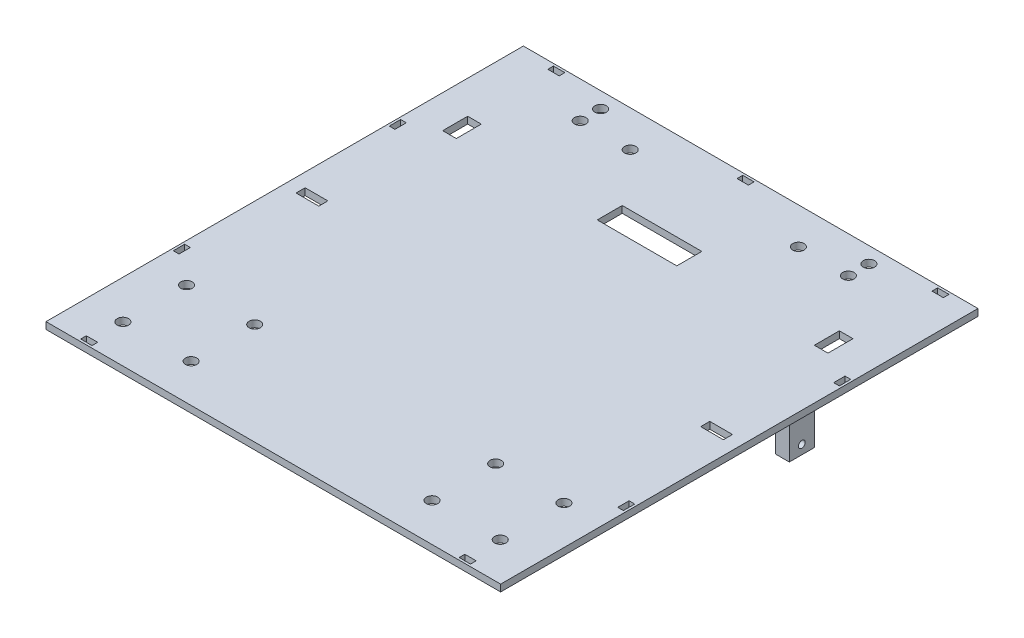
from build123d import *

# Parameters (mm, degrees)
SKETCH1_W              = 200
SKETCH1_H              = 210
SKETCH1_R              = 2.5
SKETCH1_R_2            = 2.49585759
SKETCH1_W_2            = 10
SKETCH1_H_2            = 4
SKETCH1_W_3            = 6
SKETCH1_H_3            = 11
SKETCH1_W_4            = 5
SKETCH1_H_4            = 2.5
SKETCH1_W_5            = 2.5
SKETCH1_H_5            = 5
SKETCH1_W_6            = 35
MAINBODY_DEPTH         = 1
SAYAPRODA_DEPTH        = 3
SAYAPRODA_DEPTH_BACK   = 30
SKETCH1_4_W            = 6
SKETCH1_4_H            = 11
SAYAPRODA_2_DEPTH      = 3
SAYAPRODA_2_DEPTH_BACK = 30
SKETCH9_W              = 1.5
SKETCH9_H              = 184
HOLE1_AT_2_COUNT       = 2
HOLE1_AT_2_PITCH       = 17
HOLE1_AT_3_COUNT       = 2
HOLE1_AT_3_PITCH       = 18.271297686
HOLE1_AT_4_COUNT       = 2
HOLE1_AT_4_PITCH       = 19.759178985
HOLE1_AT_5_COUNT       = 2
HOLE1_AT_5_PITCH       = 21.121723019
SKETCH1_7_W            = 200
SKETCH1_7_H            = 210
SKETCH1_7_R            = 2.5
SKETCH1_7_R_2          = 2.49585759
SKETCH1_7_W_2          = 10
SKETCH1_7_H_2          = 4
SKETCH1_7_W_3          = 6
SKETCH1_7_H_3          = 11
SKETCH1_7_W_4          = 5
SKETCH1_7_H_4          = 2.5
SKETCH1_7_W_5          = 2.5
SKETCH1_7_H_5          = 5
SKETCH1_7_W_6          = 35
BOSS_EXTRUDE1_DEPTH    = 3


with BuildPart() as part:
    # Sketch1 → MainBody (new body)
    with BuildSketch(Plane(origin=(0, 0, 0), x_dir=(1, 0, 0), z_dir=(0, 1, 0))):
        Rectangle(SKETCH1_W, SKETCH1_H)
        with Locations((-59, 98)):
            Circle(SKETCH1_R, mode=Mode.SUBTRACT)
        with Locations((-59, 89)):
            Circle(SKETCH1_R, mode=Mode.SUBTRACT)
        with Locations((-37, 89)):
            Circle(SKETCH1_R, mode=Mode.SUBTRACT)
        with Locations((59, 98)):
            Circle(SKETCH1_R, mode=Mode.SUBTRACT)
        with Locations((59, 89)):
            Circle(SKETCH1_R, mode=Mode.SUBTRACT)
        with Locations((37, 89)):
            Circle(SKETCH1_R, mode=Mode.SUBTRACT)
        with Locations((83, -88.17530204)):
            Circle(SKETCH1_R, mode=Mode.SUBTRACT)
        with Locations((83, -60.17530204)):
            Circle(SKETCH1_R_2, mode=Mode.SUBTRACT)
        with Locations((53, -88.17530204)):
            Circle(SKETCH1_R, mode=Mode.SUBTRACT)
        with Locations((53, -60.17530204)):
            Circle(SKETCH1_R, mode=Mode.SUBTRACT)
        with Locations((-83, -88.17530204)):
            Circle(SKETCH1_R, mode=Mode.SUBTRACT)
        with Locations((-53, -88.17530204)):
            Circle(SKETCH1_R, mode=Mode.SUBTRACT)
        with Locations((-53, -60.17530204)):
            Circle(SKETCH1_R, mode=Mode.SUBTRACT)
        with Locations((-83, -60.17530204)):
            Circle(SKETCH1_R, mode=Mode.SUBTRACT)
        with Locations((89, 1)):
            Rectangle(SKETCH1_W_2, SKETCH1_H_2, mode=Mode.SUBTRACT)
        with Locations((-89, 1)):
            Rectangle(SKETCH1_W_2, SKETCH1_H_2, mode=Mode.SUBTRACT)
        with Locations((-82.5, 43.5)):
            Rectangle(SKETCH1_W_3, SKETCH1_H_3, mode=Mode.SUBTRACT)
        with Locations((81, 43.5)):
            Rectangle(SKETCH1_W_3, SKETCH1_H_3, mode=Mode.SUBTRACT)
        with Locations((83.25, -102.75)):
            Rectangle(SKETCH1_W_4, SKETCH1_H_4, mode=Mode.SUBTRACT)
        with Locations((0, 102.75)):
            Rectangle(SKETCH1_W_4, SKETCH1_H_4, mode=Mode.SUBTRACT)
        with Locations((-83.25, -102.75)):
            Rectangle(SKETCH1_W_4, SKETCH1_H_4, mode=Mode.SUBTRACT)
        with Locations((-83.25, 102.75)):
            Rectangle(SKETCH1_W_4, SKETCH1_H_4, mode=Mode.SUBTRACT)
        with Locations((85.75, 102.75)):
            Rectangle(SKETCH1_W_4, SKETCH1_H_4, mode=Mode.SUBTRACT)
        with Locations((97.75, -47.5)):
            Rectangle(SKETCH1_W_5, SKETCH1_H_5, mode=Mode.SUBTRACT)
        with Locations((97.75, 47.5)):
            Rectangle(SKETCH1_W_5, SKETCH1_H_5, mode=Mode.SUBTRACT)
        with Locations((-97.75, -47.5)):
            Rectangle(SKETCH1_W_5, SKETCH1_H_5, mode=Mode.SUBTRACT)
        with Locations((-97.75, 47.5)):
            Rectangle(SKETCH1_W_5, SKETCH1_H_5, mode=Mode.SUBTRACT)
        with Locations((81, 60.5)):
            Rectangle(SKETCH1_W_3, SKETCH1_H_3, mode=Mode.SUBTRACT)
        with Locations((-82.5, 60.5)):
            Rectangle(SKETCH1_W_3, SKETCH1_H_3, mode=Mode.SUBTRACT)
        with Locations((0, 60.5)):
            Rectangle(SKETCH1_W_6, SKETCH1_H_3, mode=Mode.SUBTRACT)
    extrude(amount=MAINBODY_DEPTH)



with BuildPart() as body_2:
    # Sketch1<4> → SayapRoda (new, two sides: drawn at the far end of the back side and taken through both)
    with BuildSketch(Plane(origin=(0, 0, 0), x_dir=(1, 0, 0), z_dir=(0, 1, 0)).offset(-SAYAPRODA_DEPTH_BACK)):
        with Locations((-82.5, 43.5)):
            Rectangle(SKETCH1_4_W, SKETCH1_4_H)
    extrude(amount=SAYAPRODA_DEPTH + SAYAPRODA_DEPTH_BACK)


with BuildPart() as body_3:
    # Sketch1<4> → SayapRoda 2 (new, two sides: drawn at the far end of the back side and taken through both)
    with BuildSketch(Plane(origin=(0, 0, 0), x_dir=(1, 0, 0), z_dir=(0, 1, 0)).offset(-SAYAPRODA_2_DEPTH_BACK)):
        with Locations((81, 43.5)):
            Rectangle(SKETCH1_4_W, SKETCH1_4_H)
    extrude(amount=SAYAPRODA_2_DEPTH + SAYAPRODA_2_DEPTH_BACK)


with BuildPart() as hole1_tool:
    # Sketch9 → Hole1 (revolve)
    with BuildSketch(Plane(origin=(84, -26, -43.5), x_dir=(0, 0, -1), z_dir=(0, 1, 0))):
        with Locations((0.75, 92)):
            Rectangle(SKETCH9_W, SKETCH9_H)
    hole1 = revolve(axis=Axis((-26, -26, -43.5), (1, 0, 0)))


with BuildPart() as body_2_1:
    add(body_2.part)

    # Hole1: cut by hole1_tool
    add(hole1_tool.part, mode=Mode.SUBTRACT)


with BuildPart() as body_3_1:
    add(body_3.part)

    # Hole1: cut by hole1_tool
    add(hole1_tool.part, mode=Mode.SUBTRACT)


with BuildPart() as hole1_at_2_tool:
    # Hole1 at 2: Hole1 ×2
    with Locations(*[Vector(0, 0.999987624298452, 0.004975062807455084) * (i * HOLE1_AT_2_PITCH) for i in range(1, HOLE1_AT_2_COUNT)]):
        add(hole1)


with BuildPart() as body_2_2:
    add(body_2_1.part)

    # Hole1 at 2: cut by hole1_at_2_tool
    add(hole1_at_2_tool.part, mode=Mode.SUBTRACT)


with BuildPart() as body_3_2:
    add(body_3_1.part)

    # Hole1 at 2: cut by hole1_at_2_tool
    add(hole1_at_2_tool.part, mode=Mode.SUBTRACT)


with BuildPart() as hole1_at_3_tool:
    # Hole1 at 3: Hole1 ×2
    with Locations(*[(0, i * HOLE1_AT_3_PITCH, 0) for i in range(1, HOLE1_AT_3_COUNT)]):
        add(hole1)


with BuildPart() as body_2_3:
    add(body_2_2.part)

    # Hole1 at 3: cut by hole1_at_3_tool
    add(hole1_at_3_tool.part, mode=Mode.SUBTRACT)


with BuildPart() as body_3_3:
    add(body_3_2.part)

    # Hole1 at 3: cut by hole1_at_3_tool
    add(hole1_at_3_tool.part, mode=Mode.SUBTRACT)


with BuildPart() as hole1_at_4_tool:
    # Hole1 at 4: Hole1 ×2
    with Locations(*[(0, i * HOLE1_AT_4_PITCH, 0) for i in range(1, HOLE1_AT_4_COUNT)]):
        add(hole1)


with BuildPart() as body_2_4:
    add(body_2_3.part)

    # Hole1 at 4: cut by hole1_at_4_tool
    add(hole1_at_4_tool.part, mode=Mode.SUBTRACT)


with BuildPart() as body_3_4:
    add(body_3_3.part)

    # Hole1 at 4: cut by hole1_at_4_tool
    add(hole1_at_4_tool.part, mode=Mode.SUBTRACT)


with BuildPart() as hole1_at_5_tool:
    # Hole1 at 5: Hole1 ×2
    with Locations(*[(0, i * HOLE1_AT_5_PITCH, 0) for i in range(1, HOLE1_AT_5_COUNT)]):
        add(hole1)


with BuildPart() as body_2_5:
    add(body_2_4.part)

    # Hole1 at 5: cut by hole1_at_5_tool
    add(hole1_at_5_tool.part, mode=Mode.SUBTRACT)


with BuildPart() as body_3_5:
    add(body_3_4.part)

    # Hole1 at 5: cut by hole1_at_5_tool
    add(hole1_at_5_tool.part, mode=Mode.SUBTRACT)


with BuildPart() as part_1:
    add(part.part)

    add(body_2_5.part)  # Boss-Extrude1 merges body 2

    add(body_3_5.part)  # Boss-Extrude1 merges body 3
    # Sketch1<7> → Boss-Extrude1 (add)
    with BuildSketch(Plane(origin=(0, 0, 0), x_dir=(1, 0, 0), z_dir=(0, 1, 0))):
        Rectangle(SKETCH1_7_W, SKETCH1_7_H)
        with Locations((-59, 98)):
            Circle(SKETCH1_7_R, mode=Mode.SUBTRACT)
        with Locations((-59, 89)):
            Circle(SKETCH1_7_R, mode=Mode.SUBTRACT)
        with Locations((-37, 89)):
            Circle(SKETCH1_7_R, mode=Mode.SUBTRACT)
        with Locations((59, 98)):
            Circle(SKETCH1_7_R, mode=Mode.SUBTRACT)
        with Locations((59, 89)):
            Circle(SKETCH1_7_R, mode=Mode.SUBTRACT)
        with Locations((37, 89)):
            Circle(SKETCH1_7_R, mode=Mode.SUBTRACT)
        with Locations((83, -88.17530204)):
            Circle(SKETCH1_7_R, mode=Mode.SUBTRACT)
        with Locations((83, -60.17530204)):
            Circle(SKETCH1_7_R_2, mode=Mode.SUBTRACT)
        with Locations((53, -88.17530204)):
            Circle(SKETCH1_7_R, mode=Mode.SUBTRACT)
        with Locations((53, -60.17530204)):
            Circle(SKETCH1_7_R, mode=Mode.SUBTRACT)
        with Locations((-83, -88.17530204)):
            Circle(SKETCH1_7_R, mode=Mode.SUBTRACT)
        with Locations((-53, -88.17530204)):
            Circle(SKETCH1_7_R, mode=Mode.SUBTRACT)
        with Locations((-53, -60.17530204)):
            Circle(SKETCH1_7_R, mode=Mode.SUBTRACT)
        with Locations((-83, -60.17530204)):
            Circle(SKETCH1_7_R, mode=Mode.SUBTRACT)
        with Locations((89, 1)):
            Rectangle(SKETCH1_7_W_2, SKETCH1_7_H_2, mode=Mode.SUBTRACT)
        with Locations((-89, 1)):
            Rectangle(SKETCH1_7_W_2, SKETCH1_7_H_2, mode=Mode.SUBTRACT)
        with Locations((-82.5, 43.5)):
            Rectangle(SKETCH1_7_W_3, SKETCH1_7_H_3, mode=Mode.SUBTRACT)
        with Locations((81, 43.5)):
            Rectangle(SKETCH1_7_W_3, SKETCH1_7_H_3, mode=Mode.SUBTRACT)
        with Locations((83.25, -102.75)):
            Rectangle(SKETCH1_7_W_4, SKETCH1_7_H_4, mode=Mode.SUBTRACT)
        with Locations((0, 102.75)):
            Rectangle(SKETCH1_7_W_4, SKETCH1_7_H_4, mode=Mode.SUBTRACT)
        with Locations((-83.25, -102.75)):
            Rectangle(SKETCH1_7_W_4, SKETCH1_7_H_4, mode=Mode.SUBTRACT)
        with Locations((-83.25, 102.75)):
            Rectangle(SKETCH1_7_W_4, SKETCH1_7_H_4, mode=Mode.SUBTRACT)
        with Locations((85.75, 102.75)):
            Rectangle(SKETCH1_7_W_4, SKETCH1_7_H_4, mode=Mode.SUBTRACT)
        with Locations((97.75, -47.5)):
            Rectangle(SKETCH1_7_W_5, SKETCH1_7_H_5, mode=Mode.SUBTRACT)
        with Locations((97.75, 47.5)):
            Rectangle(SKETCH1_7_W_5, SKETCH1_7_H_5, mode=Mode.SUBTRACT)
        with Locations((-97.75, -47.5)):
            Rectangle(SKETCH1_7_W_5, SKETCH1_7_H_5, mode=Mode.SUBTRACT)
        with Locations((-97.75, 47.5)):
            Rectangle(SKETCH1_7_W_5, SKETCH1_7_H_5, mode=Mode.SUBTRACT)
        with Locations((81, 60.5)):
            Rectangle(SKETCH1_7_W_3, SKETCH1_7_H_3, mode=Mode.SUBTRACT)
        with Locations((-82.5, 60.5)):
            Rectangle(SKETCH1_7_W_3, SKETCH1_7_H_3, mode=Mode.SUBTRACT)
        with Locations((0, 60.5)):
            Rectangle(SKETCH1_7_W_6, SKETCH1_7_H_3, mode=Mode.SUBTRACT)
    extrude(amount=BOSS_EXTRUDE1_DEPTH)


solid = part_1.part
